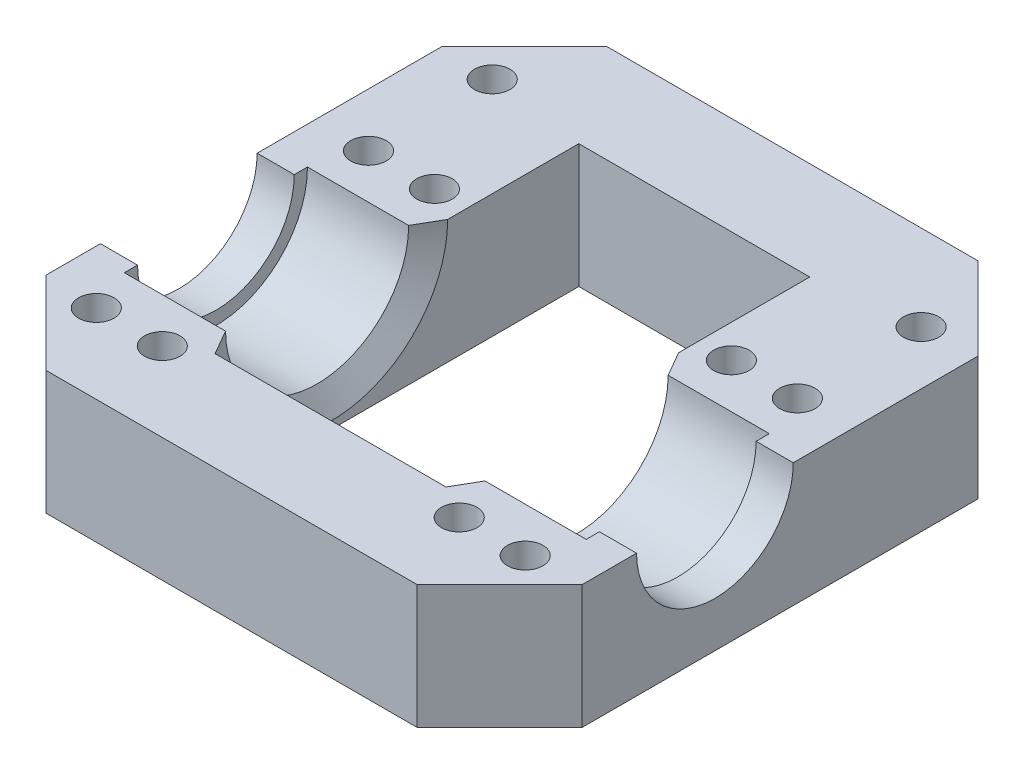
from build123d import *
from OCP.BRepFilletAPI import BRepFilletAPI_MakeChamfer

# Parameters (mm, degrees)
SKETCH1_W                = 65
SKETCH1_H                = 100
SKETCH1_W_2              = 28
SKETCH1_H_2              = 80
BOSS_EXTRUDE1_DEPTH      = 15
SKETCH3_W                = 14
SKETCH3_H                = 11.1
SKETCH4_R                = 9.5
CUT_EXTRUDE2_DEPTH       = 84.366660003
SKETCH8_R                = 2.15
CUT_EXTRUDE6_DEPTH       = 62.491869381
FILLET1_R                = 20
CHAMFER1_SIZE            = 3
CHAMFER1_SIZE2           = 1.732050808
SKETCH10_W               = 30
SKETCH10_H               = 5.5
BOSS_EXTRUDE2_DEPTH      = 20
BOSS_EXTRUDE3_START      = 13
SKETCH12_W               = 30
SKETCH12_H               = 3.7
BOSS_EXTRUDE3_DEPTH      = 7
BOSS_EXTRUDE4_DEPTH      = 1.3
CHAMFER3_SIZE            = 10
CHAMFER3_SIZE2           = 5.773502692
BOSS_EXTRUDE6_DEPTH      = 28
SKETCH16_W               = 65
SKETCH16_H               = 26.184127578
CUT_EXTRUDE7_DEPTH       = 75.035464475
SKETCH17_W               = 28
SKETCH17_H               = 10
BOSS_EXTRUDE7_DEPTH      = 15
SKETCH18_W               = 65
SKETCH18_H               = 20
BOSS_EXTRUDE8_DEPTH      = 15
SKETCH19_W               = 65
SKETCH19_H               = 8.1
CUT_EXTRUDE8_DEPTH       = 75.035464475
CHAMFER4_SIZE2           = 2.438662943
CHAMFER4_SIZE            = 5
CUT_EXTRUDE10_DEPTH      = 3
CHAMFER5_SIZE            = 10
SKETCH26_R               = 2.15
CUT_EXTRUDE11_DEPTH      = 69.824850163
CUT_EXTRUDE12_DEPTH      = 68.838853174
CUT_EXTRUDE12_DEPTH_BACK = 68.838853174
CHAMFER6_SIZE            = 0.6
CHAMFER6_SIZE2           = 0.218382141


with BuildPart() as part:
    # Sketch1 → Boss-Extrude1 (new body)
    with BuildSketch(Plane(origin=(0, 0, 0), x_dir=(1, 0, 0), z_dir=(0, 1, 0))):
        Rectangle(SKETCH1_W, SKETCH1_H)
        Rectangle(SKETCH1_W_2, SKETCH1_H_2, mode=Mode.SUBTRACT)
    extrude(amount=BOSS_EXTRUDE1_DEPTH)

    # Sketch3 → Cut-Revolve1 (revolve, cut)
    with BuildSketch(Plane(origin=(0, 15, 0), x_dir=(1, 0, 0), z_dir=(0, 1, 0))):
        with Locations((21, -5.55)):
            Rectangle(SKETCH3_W, SKETCH3_H)
        with Locations((-21, -5.55)):
            Rectangle(SKETCH3_W, SKETCH3_H)
    revolve(axis=Axis((14, 15, 0), (1, 0, 0)), mode=Mode.SUBTRACT)

    # Sketch4 → Cut-Extrude2 (cut, through all)
    with BuildSketch(Plane(origin=(32.5, 0, 0), x_dir=(0, 0, -1), z_dir=(1, 0, 0))):
        with Locations((0, 15)):
            Circle(SKETCH4_R)
    extrude(amount=-CUT_EXTRUDE2_DEPTH, mode=Mode.SUBTRACT)

    # Sketch8 → Cut-Extrude6 (cut, through all)
    with BuildSketch(Plane(origin=(0, 15, 0), x_dir=(1, 0, 0), z_dir=(0, 1, 0))):
        with Locations(Location((18, 16.5, 0), (0, 0, 270))):
            Circle(SKETCH8_R)
        with Locations(Location((18, -16.5, 0), (0, 0, 270))):
            Circle(SKETCH8_R)
        with Locations(Location((-18, -16.5, 0), (0, 0, 270))):
            Circle(SKETCH8_R)
        with Locations(Location((-18, 16.5, 0), (0, 0, 270))):
            Circle(SKETCH8_R)
        with Locations((9, -27)):
            Circle(SKETCH8_R)
        with Locations((-9, -27)):
            Circle(SKETCH8_R)
        with Locations((-9, 27)):
            Circle(SKETCH8_R)
        with Locations((9, 27)):
            Circle(SKETCH8_R)
        with Locations(Location((-26, 16.5, 0), (0, 0, 270))):
            Circle(SKETCH8_R)
        with Locations(Location((26, 16.5, 0), (0, 0, 270))):
            Circle(SKETCH8_R)
        with Locations(Location((26, -16.5, 0), (0, 0, 270))):
            Circle(SKETCH8_R)
        with Locations(Location((-26, -16.5, 0), (0, 0, 270))):
            Circle(SKETCH8_R)
    extrude(amount=-CUT_EXTRUDE6_DEPTH, mode=Mode.SUBTRACT)

    # Fillet1
    fillet1_edges = [part.edges().sort_by_distance(p)[0] for p in [
        (-32.5, 7.5, -50),
        (32.5, 7.5, -50),
        (32.5, 7.5, 50),
        (-32.5, 7.5, 50),
    ]]
    fillet(fillet1_edges, radius=FILLET1_R)

    # Chamfer1: one chamfer whose edges measure the first distance from different faces: ONE call of the kernel's chamfer builder (chamfer() names one face for all edges)
    chamfer1_edges_1 = [part.edges().sort_by_distance(p)[0] for p in [
        (14, 3.9, 0),
    ]]
    chamfer1_side_1 = [part.faces().sort_by_distance(p)[0] for p in [
        (14, 0.81394103, 0),
    ]]
    chamfer1_edges_2 = [part.edges().sort_by_distance(p)[0] for p in [
        (-14, 3.9, 0),
    ]]
    chamfer1_side_2 = [part.faces().sort_by_distance(p)[0] for p in [
        (-14, 0.81394103, 0),
    ]]
    chamfer1 = BRepFilletAPI_MakeChamfer(part.part.solid().wrapped)
    for e in chamfer1_edges_1:
        chamfer1.Add(CHAMFER1_SIZE, CHAMFER1_SIZE2, e.wrapped, chamfer1_side_1[0].wrapped)  # the first distance lies on this face
    for e in chamfer1_edges_2:
        chamfer1.Add(CHAMFER1_SIZE, CHAMFER1_SIZE2, e.wrapped, chamfer1_side_2[0].wrapped)  # the first distance lies on this face
    add(Compound.cast(chamfer1.Shape()), mode=Mode.REPLACE)

    # Sketch10 → Boss-Extrude2 (add)
    with BuildSketch(Plane.ZY.offset(32.5)):
        with Locations((0, 2.75)):
            Rectangle(SKETCH10_W, SKETCH10_H)
    extrude(amount=BOSS_EXTRUDE2_DEPTH)

    # Sketch12 → Boss-Extrude3 (add)
    with BuildSketch(Plane.ZY.offset(32.5).offset(BOSS_EXTRUDE3_START)):
        with Locations((0, 7.35)):
            Rectangle(SKETCH12_W, SKETCH12_H)
    extrude(amount=BOSS_EXTRUDE3_DEPTH)

    # Sketch13 → Boss-Extrude4 (add)
    with BuildSketch(Plane(origin=(0, 9.2, 0), x_dir=(1, 0, 0), z_dir=(0, 1, 0))):
        Polygon((-51.4, 2.2), (-51.4, 1.6), (-52.5, 1.6), (-52.5, 15), (-45.5, 15), (-45.5, -15), (-52.5, -15), (-52.5, -1.6), (-51.4, -1.6), (-51.4, -2.2), (-48.2, -2.2), (-48.2, 2.2), align=None)
    extrude(amount=BOSS_EXTRUDE4_DEPTH)

    # Chamfer3: one chamfer whose edges measure the first distance from different faces: ONE call of the kernel's chamfer builder (chamfer() names one face for all edges)
    chamfer3_edges_1 = [part.edges().sort_by_distance(p)[0] for p in [
        (-52.5, 5.25, -15),
    ]]
    chamfer3_side_1 = [part.faces().sort_by_distance(p)[0] for p in [
        (-44.068965517, 4.017241379, -15),
    ]]
    chamfer3_edges_2 = [part.edges().sort_by_distance(p)[0] for p in [
        (-52.5, 5.25, 15),
    ]]
    chamfer3_side_2 = [part.faces().sort_by_distance(p)[0] for p in [
        (-44.068965517, 4.017241379, 15),
    ]]
    chamfer3 = BRepFilletAPI_MakeChamfer(part.part.solid().wrapped)
    for e in chamfer3_edges_1:
        chamfer3.Add(CHAMFER3_SIZE, CHAMFER3_SIZE2, e.wrapped, chamfer3_side_1[0].wrapped)  # the first distance lies on this face
    for e in chamfer3_edges_2:
        chamfer3.Add(CHAMFER3_SIZE, CHAMFER3_SIZE2, e.wrapped, chamfer3_side_2[0].wrapped)  # the first distance lies on this face
    add(Compound.cast(chamfer3.Shape()), mode=Mode.REPLACE)

    # Sketch15 → Boss-Extrude6 (add)
    with BuildSketch(Plane(origin=(-14, 0, 0), x_dir=(0, 0, -1), z_dir=(1, 0, 0))):
        with BuildLine():
            Line((-12.8, 9.086456223), (-12.8, 0))
            Line((-12.8, 0), (-40, 0))
            Line((-40, 0), (-40, 15))
            Line((-40, 15), (-14.1, 15))
            ThreePointArc((-14.1, 15), (-13.771165528, 11.972624899), (-12.8, 9.086456223))
        make_face()
    extrude(amount=BOSS_EXTRUDE6_DEPTH)

    # Sketch16 → Cut-Extrude7 (cut, through all)
    with BuildSketch(Plane(origin=(0, 15, 0), x_dir=(1, 0, 0), z_dir=(0, 1, 0))):
        with Locations((0, -39.192063789)):
            Rectangle(SKETCH16_W, SKETCH16_H)
    extrude(amount=-CUT_EXTRUDE7_DEPTH, mode=Mode.SUBTRACT)

    # Sketch17 → Boss-Extrude7 (add)
    with BuildSketch(Plane(origin=(0, 15, 0), x_dir=(1, 0, 0), z_dir=(0, 1, 0))):
        with Locations((0, 35)):
            Rectangle(SKETCH17_W, SKETCH17_H)
    extrude(amount=-BOSS_EXTRUDE7_DEPTH)

    # Sketch18 → Boss-Extrude8 (add)
    with BuildSketch(Plane(origin=(0, 15, 0), x_dir=(1, 0, 0), z_dir=(0, 1, 0))):
        with Locations((0, 40)):
            Rectangle(SKETCH18_W, SKETCH18_H)
    extrude(amount=-BOSS_EXTRUDE8_DEPTH)

    # Sketch19 → Cut-Extrude8 (cut, through all)
    with BuildSketch(Plane(origin=(0, 15, 0), x_dir=(1, 0, 0), z_dir=(0, 1, 0))):
        with Locations((0, 45.95)):
            Rectangle(SKETCH19_W, SKETCH19_H)
    extrude(amount=-CUT_EXTRUDE8_DEPTH, mode=Mode.SUBTRACT)

    # Chamfer4
    chamfer4_edges = [part.edges().sort_by_distance(p)[0] for p in [
        (-45.5, 10.5, 0),
    ]]
    chamfer4_side = [part.faces().sort_by_distance(p)[0] for p in [
        (-45.5, 10.451226741, 0),
    ]]
    chamfer(chamfer4_edges, length=CHAMFER4_SIZE - 0.0001, length2=CHAMFER4_SIZE2 - 0.0001, reference=chamfer4_side[0])  # a hair under: the kernel refuses the full size

    # Sketch21 → Cut-Extrude10 (cut)
    with BuildSketch(Plane.XZ):
        Polygon((-32.5, -5), (-32.5, 15), (-42.5, 15), (-42.5, 5), (-52.5, 5), (-52.5, -5), align=None)
    extrude(amount=-CUT_EXTRUDE10_DEPTH, mode=Mode.SUBTRACT)

    # Chamfer5
    chamfer5_edges = [part.edges().sort_by_distance(p)[0] for p in [
        (-32.5, 7.5, 26.1),
        (32.5, 7.5, 26.1),
        (32.5, 7.5, -41.9),
        (-32.5, 7.5, -41.9),
    ]]
    chamfer(chamfer5_edges, length=CHAMFER5_SIZE)

    # Sketch26 → Cut-Extrude11 (cut, through all)
    with BuildSketch(Plane(origin=(0, 15, 0), x_dir=(1, 0, 0), z_dir=(0, 1, 0))):
        with Locations(Location((-26, 31.5, 0), (0, 0, 270))):
            Circle(SKETCH26_R)
        with Locations(Location((26, 31.5, 0), (0, 0, 270))):
            Circle(SKETCH26_R)
    extrude(amount=-CUT_EXTRUDE11_DEPTH, mode=Mode.SUBTRACT)

    # Sketch27 → Cut-Extrude12 (cut, two sides: drawn at the far end of the back side and taken through both)
    with BuildSketch(Plane(origin=(0, 5.5, 0), x_dir=(1, 0, 0), z_dir=(0, 1, 0)).offset(-CUT_EXTRUDE12_DEPTH_BACK)):
        Polygon((-32.5, 15), (-61.168127917, 15), (-61.168127917, -18.062525398), (-32.5, -15), align=None)
    extrude(amount=CUT_EXTRUDE12_DEPTH + CUT_EXTRUDE12_DEPTH_BACK, mode=Mode.SUBTRACT)

    # Chamfer6: one chamfer whose edges measure the first distance from different faces: ONE call of the kernel's chamfer builder (chamfer() names one face for all edges)
    chamfer6_edges_1 = [part.edges().sort_by_distance(p)[0] for p in [
        (-26, 0, -33.65),
    ]]
    chamfer6_side_1 = [part.faces().sort_by_distance(p)[0] for p in [
        (-26, 7.5, -33.65),
    ]]
    chamfer6_edges_2 = [part.edges().sort_by_distance(p)[0] for p in [
        (26, 0, -33.65),
    ]]
    chamfer6_side_2 = [part.faces().sort_by_distance(p)[0] for p in [
        (26, 7.5, -33.65),
    ]]
    chamfer6_edges_3 = [part.edges().sort_by_distance(p)[0] for p in [
        (18, 0, -18.65),
    ]]
    chamfer6_side_3 = [part.faces().sort_by_distance(p)[0] for p in [
        (18, 7.5, -18.65),
    ]]
    chamfer6_edges_4 = [part.edges().sort_by_distance(p)[0] for p in [
        (26, 0, -18.65),
    ]]
    chamfer6_side_4 = [part.faces().sort_by_distance(p)[0] for p in [
        (26, 7.5, -18.65),
    ]]
    chamfer6_edges_5 = [part.edges().sort_by_distance(p)[0] for p in [
        (26, 0, 14.35),
    ]]
    chamfer6_side_5 = [part.faces().sort_by_distance(p)[0] for p in [
        (26, 7.5, 14.35),
    ]]
    chamfer6_edges_6 = [part.edges().sort_by_distance(p)[0] for p in [
        (-26, 0, 14.35),
    ]]
    chamfer6_side_6 = [part.faces().sort_by_distance(p)[0] for p in [
        (-26, 7.5, 14.35),
    ]]
    chamfer6_edges_7 = [part.edges().sort_by_distance(p)[0] for p in [
        (18, 0, 14.35),
    ]]
    chamfer6_side_7 = [part.faces().sort_by_distance(p)[0] for p in [
        (18, 7.5, 14.35),
    ]]
    chamfer6_edges_8 = [part.edges().sort_by_distance(p)[0] for p in [
        (-18, 0, 14.35),
    ]]
    chamfer6_side_8 = [part.faces().sort_by_distance(p)[0] for p in [
        (-18, 7.5, 14.35),
    ]]
    chamfer6_edges_9 = [part.edges().sort_by_distance(p)[0] for p in [
        (-26, 0, -18.65),
    ]]
    chamfer6_side_9 = [part.faces().sort_by_distance(p)[0] for p in [
        (-26, 7.5, -18.65),
    ]]
    chamfer6_edges_10 = [part.edges().sort_by_distance(p)[0] for p in [
        (-18, 0, -18.65),
    ]]
    chamfer6_side_10 = [part.faces().sort_by_distance(p)[0] for p in [
        (-18, 7.5, -18.65),
    ]]
    chamfer6 = BRepFilletAPI_MakeChamfer(part.part.solid().wrapped)
    for e in chamfer6_edges_1:
        chamfer6.Add(CHAMFER6_SIZE, CHAMFER6_SIZE2, e.wrapped, chamfer6_side_1[0].wrapped)  # the first distance lies on this face
    for e in chamfer6_edges_2:
        chamfer6.Add(CHAMFER6_SIZE, CHAMFER6_SIZE2, e.wrapped, chamfer6_side_2[0].wrapped)  # the first distance lies on this face
    for e in chamfer6_edges_3:
        chamfer6.Add(CHAMFER6_SIZE, CHAMFER6_SIZE2, e.wrapped, chamfer6_side_3[0].wrapped)  # the first distance lies on this face
    for e in chamfer6_edges_4:
        chamfer6.Add(CHAMFER6_SIZE, CHAMFER6_SIZE2, e.wrapped, chamfer6_side_4[0].wrapped)  # the first distance lies on this face
    for e in chamfer6_edges_5:
        chamfer6.Add(CHAMFER6_SIZE, CHAMFER6_SIZE2, e.wrapped, chamfer6_side_5[0].wrapped)  # the first distance lies on this face
    for e in chamfer6_edges_6:
        chamfer6.Add(CHAMFER6_SIZE, CHAMFER6_SIZE2, e.wrapped, chamfer6_side_6[0].wrapped)  # the first distance lies on this face
    for e in chamfer6_edges_7:
        chamfer6.Add(CHAMFER6_SIZE, CHAMFER6_SIZE2, e.wrapped, chamfer6_side_7[0].wrapped)  # the first distance lies on this face
    for e in chamfer6_edges_8:
        chamfer6.Add(CHAMFER6_SIZE, CHAMFER6_SIZE2, e.wrapped, chamfer6_side_8[0].wrapped)  # the first distance lies on this face
    for e in chamfer6_edges_9:
        chamfer6.Add(CHAMFER6_SIZE, CHAMFER6_SIZE2, e.wrapped, chamfer6_side_9[0].wrapped)  # the first distance lies on this face
    for e in chamfer6_edges_10:
        chamfer6.Add(CHAMFER6_SIZE, CHAMFER6_SIZE2, e.wrapped, chamfer6_side_10[0].wrapped)  # the first distance lies on this face
    add(Compound.cast(chamfer6.Shape()), mode=Mode.REPLACE)


solid = part.part
